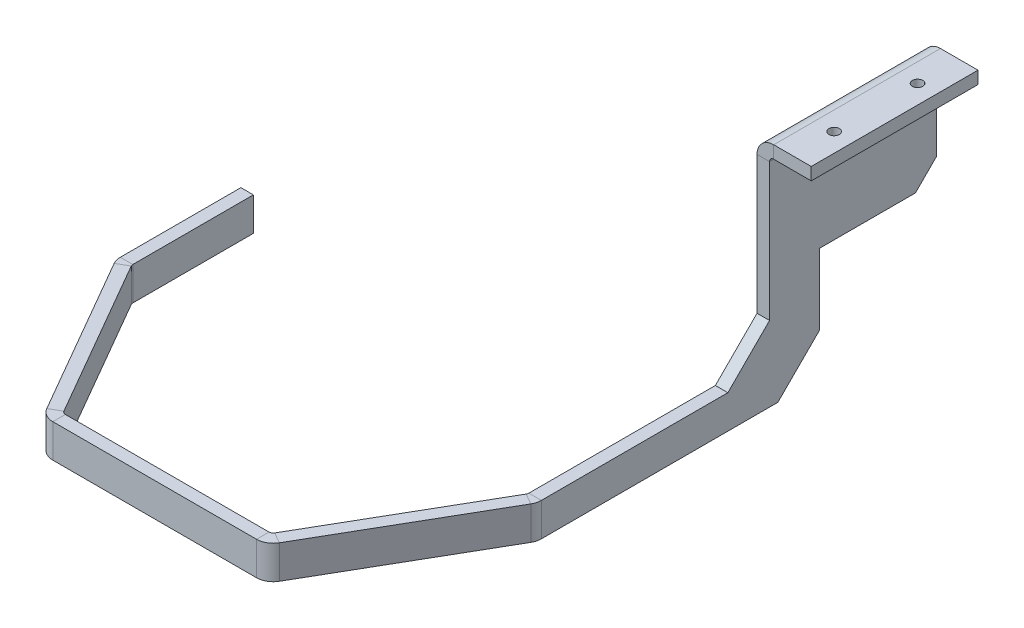
from build123d import *

# Parameters (mm, degrees)
SM_BASE_FLANGE_1_DEPTH           = 40
M3X0_5_1_D                       = 2.5
SKETCH_22_W                      = 3
SKETCH_22_H                      = 12
EXTRUDE_6_DEPTH                  = 19
SKETCH_23_W                      = 3
SKETCH_23_H                      = 67
EXTRUDE_7_DEPTH                  = 8
CHAMFER_1_SIZE                   = 10
CHAMFER_2_SIZE                   = 5
SM_EDGE_FLANGE_1_STRIP_CUT_DEPTH = 8
SM_EDGE_FLANGE_1_DEPTH           = 8
SM_EDGE_FLANGE_2_STRIP_CUT_DEPTH = 8
SM_EDGE_FLANGE_2_DEPTH           = 8
SM_EDGE_FLANGE_3_STRIP_CUT_DEPTH = 8
SM_EDGE_FLANGE_3_DEPTH           = 8
SM_EDGE_FLANGE_4_STRIP_CUT_DEPTH = 8
SM_EDGE_FLANGE_4_DEPTH           = 8


# Sheet-metal steps are written as plain solids
with BuildPart() as part:
    # 草圖3 → 基材-凸緣1 (new body)
    with BuildSketch(Plane.XY):
        with BuildLine():
            Line((10, 0), (1, 0))
            ThreePointArc((1, 0), (0.292893219, -0.292893219), (0, -1))
            Line((0, -1), (0, -25))
            Line((0, -25), (-3, -25))
            Line((-3, -25), (-3, -1))
            ThreePointArc((-3, -1), (-1.828427125, 1.828427125), (1, 3))
            Line((1, 3), (10, 3))
            Line((10, 3), (10, 0))
        make_face()
    extrude(amount=SM_BASE_FLANGE_1_DEPTH)

    # M3x0.5 螺紋孔1 (through all)
    with Locations(Plane(origin=(0, 3, 0), x_dir=(1, 0, 0), z_dir=(0, 1, 0))):
        with Locations((5.5, -30), (5.5, -10)):
            Hole(M3X0_5_1_D / 2)

    # 草圖22 → 填料-伸長6 (add)
    with BuildSketch(Plane.XZ.offset(25)):
        with Locations((-1.5, 34)):
            Rectangle(SKETCH_22_W, SKETCH_22_H)
    extrude(amount=EXTRUDE_6_DEPTH)

    # 草圖23 → 填料-伸長7 (add)
    with BuildSketch(Plane.XZ.offset(44)):
        with Locations((-1.5, 61.5)):
            Rectangle(SKETCH_23_W, SKETCH_23_H)
    extrude(amount=EXTRUDE_7_DEPTH)

    # 導角1
    chamfer_1_edges = [part.edges().sort_by_distance(p)[0] for p in [
        (-1.5, -44, 40),
        (-1.5, -52, 28),
    ]]
    chamfer(chamfer_1_edges, length=CHAMFER_1_SIZE)

    # 導角2
    chamfer_2_edges = [part.edges().sort_by_distance(p)[0] for p in [
        (-1.5, -25, 0),
    ]]
    chamfer(chamfer_2_edges, length=CHAMFER_2_SIZE)

    # 邊線-凸緣1 strip (across the edge) → 邊線-凸緣1 strip cut (cut)
    with BuildSketch(Plane(origin=(-3, -52, 95), x_dir=(-0.8660254037844416, 0, -0.49999999999999495), z_dir=(0, 1, 0))):
        Polygon((-9.464101615, 10.392304845), (-2.464101615, -1.732050808), (0.133974596, -0.232050808), (-6.866025404, 11.892304845), align=None)
    extrude(amount=SM_EDGE_FLANGE_1_STRIP_CUT_DEPTH, mode=Mode.SUBTRACT)

    # 邊線-凸緣1 section (across the edge) → 邊線-凸緣1 (add)
    with BuildSketch(Plane(origin=(-3, -52, 95), x_dir=(-0.8660254037844416, 0, -0.49999999999999495), z_dir=(0, 1, 0))):
        with BuildLine():
            Line((-3, 0.267949192), (-3, 45))
            Line((-3, 45), (0, 45))
            Line((0, 45), (0, 0.267949192))
            ThreePointArc((0, 0.267949192), (0.034074174, 0.009130147), (0.133974596, -0.232050808))
            Line((0.133974596, -0.232050808), (-2.464101615, -1.732050808))
            ThreePointArc((-2.464101615, -1.732050808), (-2.863703305, -0.767326988), (-3, 0.267949192))
        make_face()
    extrude(amount=SM_EDGE_FLANGE_1_DEPTH)

    # 邊線-凸緣2 strip (across the edge) → 邊線-凸緣2 strip cut (cut)
    with BuildSketch(Plane(origin=(-25.5, -52, 133.97114317), x_dir=(0, 0, -1), z_dir=(0, 1, 0))):
        Polygon((-13.124355653, 4.113248654), (-1, -2.886751346), (0.5, -0.288675135), (-11.624355653, 6.711324865), align=None)
    extrude(amount=SM_EDGE_FLANGE_2_STRIP_CUT_DEPTH, mode=Mode.SUBTRACT)

    # 邊線-凸緣2 section (across the edge) → 邊線-凸緣2 (add)
    with BuildSketch(Plane(origin=(-25.5, -52, 133.97114317), x_dir=(0, 0, -1), z_dir=(0, 1, 0))):
        with BuildLine():
            Line((-3, 0.577350269), (-3, 50))
            Line((-3, 50), (0, 50))
            Line((0, 50), (0, 0.577350269))
            ThreePointArc((0, 0.577350269), (0.133974596, 0.077350269), (0.5, -0.288675135))
            Line((0.5, -0.288675135), (-1, -2.886751346))
            ThreePointArc((-1, -2.886751346), (-2.464101615, -1.422649731), (-3, 0.577350269))
        make_face()
    extrude(amount=SM_EDGE_FLANGE_2_DEPTH)

    # 邊線-凸緣3 strip (across the edge) → 邊線-凸緣3 strip cut (cut)
    with BuildSketch(Plane(origin=(-75.5, -52, 133.97114317), x_dir=(0.8660254037844312, -1.5023145987371476e-15, -0.5000000000000132), z_dir=(0, 1, 0))):
        Polygon((-13.124355653, 4.113248654), (-1, -2.886751346), (0.5, -0.288675135), (-11.624355653, 6.711324865), align=None)
    extrude(amount=SM_EDGE_FLANGE_3_STRIP_CUT_DEPTH, mode=Mode.SUBTRACT)

    # 邊線-凸緣3 section (across the edge) → 邊線-凸緣3 (add)
    with BuildSketch(Plane(origin=(-75.5, -52, 133.97114317), x_dir=(0.8660254037844312, -1.5023145987371476e-15, -0.5000000000000132), z_dir=(0, 1, 0))):
        with BuildLine():
            Line((-3, 0.577350269), (-3, 45))
            Line((-3, 45), (0, 45))
            Line((0, 45), (0, 0.577350269))
            ThreePointArc((0, 0.577350269), (0.133974596, 0.077350269), (0.5, -0.288675135))
            Line((0.5, -0.288675135), (-1, -2.886751346))
            ThreePointArc((-1, -2.886751346), (-2.464101615, -1.422649731), (-3, 0.577350269))
        make_face()
    extrude(amount=SM_EDGE_FLANGE_3_DEPTH)

    # 邊線-凸緣4 strip (across the edge) → 邊線-凸緣4 strip cut (cut)
    with BuildSketch(Plane(origin=(-98, -52, 95), x_dir=(1, 0, 0), z_dir=(0, 1, 0))):
        Polygon((-9.464101615, 10.392304845), (-2.464101615, -1.732050808), (0.133974596, -0.232050808), (-6.866025404, 11.892304845), align=None)
    extrude(amount=SM_EDGE_FLANGE_4_STRIP_CUT_DEPTH, mode=Mode.SUBTRACT)

    # 邊線-凸緣4 section (across the edge) → 邊線-凸緣4 (add)
    with BuildSketch(Plane(origin=(-98, -52, 95), x_dir=(1, 0, 0), z_dir=(0, 1, 0))):
        with BuildLine():
            Line((-3, 0.267949192), (-3, 29.196152423))
            Line((-3, 29.196152423), (0, 29.196152423))
            Line((0, 29.196152423), (0, 0.267949192))
            ThreePointArc((0, 0.267949192), (0.034074174, 0.009130147), (0.133974596, -0.232050808))
            Line((0.133974596, -0.232050808), (-2.464101615, -1.732050808))
            ThreePointArc((-2.464101615, -1.732050808), (-2.863703305, -0.767326988), (-3, 0.267949192))
        make_face()
    extrude(amount=SM_EDGE_FLANGE_4_DEPTH)


solid = part.part
